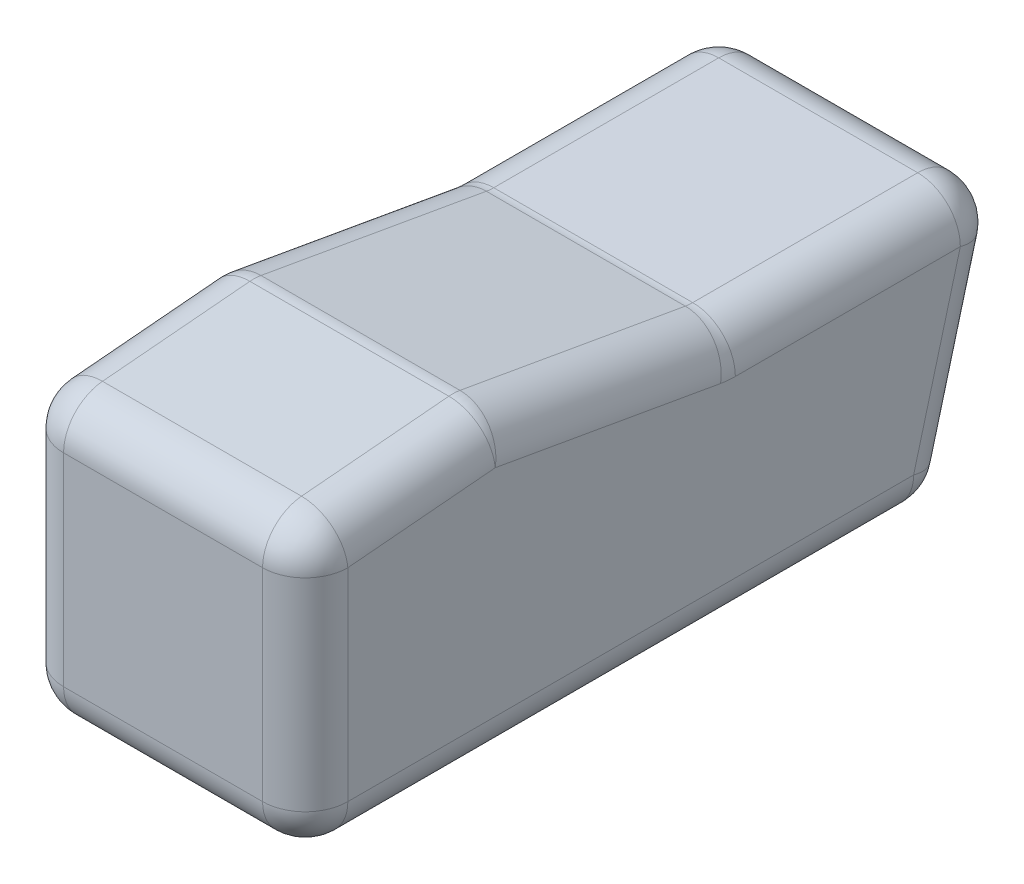
from build123d import *

# Parameters (mm, degrees)
AUFSATZ_LINEAR_AUSTRAGEN1_DEPTH      = 1500
AUFSATZ_LINEAR_AUSTRAGEN1_DEPTH_BACK = 1500
VERRUNDUNG1_R                        = 450


with BuildPart() as part:
    # Skizze2 → Aufsatz-Linear austragen1 (new, two sides: drawn at the far end of the back side and taken through both)
    with BuildSketch(Plane(origin=(0, 0, 0), x_dir=(0, 0, -1), z_dir=(1, 0, 0)).offset(-AUFSATZ_LINEAR_AUSTRAGEN1_DEPTH_BACK)):
        Polygon((1000, -1500), (1000, 1500), (3025, 1677.16454364), (5500, 1240.755266387), (8500, 1240.755266387), (7765.61683972, -1500), align=None)
    extrude(amount=AUFSATZ_LINEAR_AUSTRAGEN1_DEPTH + AUFSATZ_LINEAR_AUSTRAGEN1_DEPTH_BACK)

    # Verrundung1
    verrundung1_edges = [part.edges().sort_by_distance(p)[0] for p in [
        (-1500, 1240.755266387, -7000),
        (0, 1240.755266387, -8500),
        (1500, 1240.755266387, -7000),
        (-1500, 1458.959905013, -4262.5),
        (0, 1240.755266387, -5500),
        (1500, 1458.959905013, -4262.5),
        (-1500, 1588.58227182, -2012.5),
        (0, 1677.16454364, -3025),
        (1500, 1588.58227182, -2012.5),
        (0, 1500, -1000),
        (0, -1500, -1000),
        (-1500, 0, -1000),
        (-1500, -1500, -4382.80841986),
        (-1500, -129.622366807, -8132.80841986),
        (0, -1500, -7765.61683972),
        (1500, -129.622366807, -8132.80841986),
        (1500, -1500, -4382.80841986),
        (1500, 0, -1000),
    ]]
    fillet(verrundung1_edges, radius=VERRUNDUNG1_R)


solid = part.part
